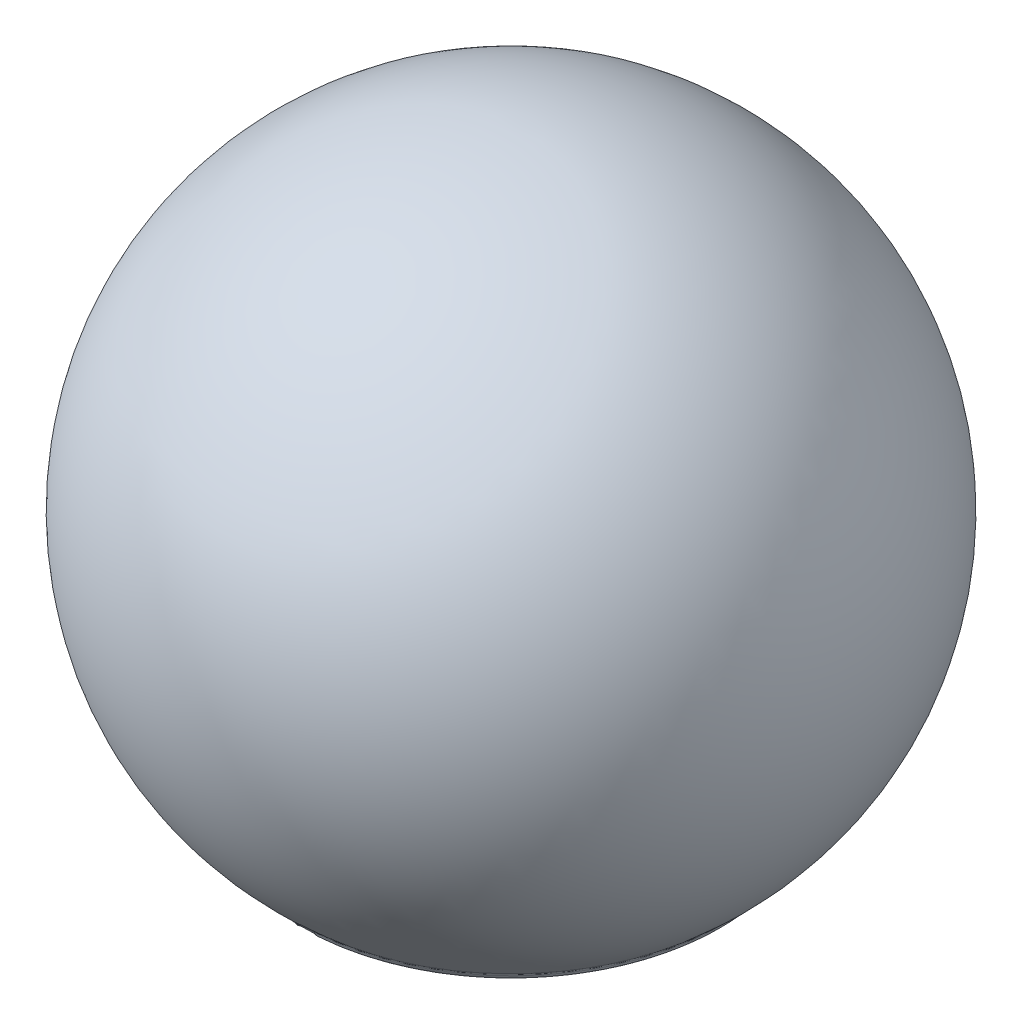
from build123d import *

# Parameters (mm, degrees)
CUT_EXTRUDE1_DEPTH = 65
SKETCH4_W          = 2.495898364
SKETCH4_H          = 1.5
FILLET1_R          = 1.5
FILLET2_R          = 1.5
FILLET3_R          = 1.5


with BuildPart() as part:
    # Sketch1 → Revolve1 (revolve)
    with BuildSketch(Plane.XY):
        with BuildLine():
            Line((0, 74.75), (0, 73.175))
            ThreePointArc((0, 73.175), (73.175, 0), (0, -73.175))
            Line((0, -73.175), (0, -74.75))
            ThreePointArc((0, -74.75), (74.75, 0), (0, 74.75))
        make_face()
    revolve(axis=Axis((0, 74.75, 0), (0, -1, 0)))

    # Sketch3 → Cut-Extrude1 (cut, symmetric)
    with BuildSketch(Plane.XY):
        Polygon((45.425, -57.368545389), (-45.425, -57.368545389), (-47.920898364, -57.368545389), (-47.920898364, -74.75), (47.920898364, -74.75), (47.920898364, -57.368545389), align=None)
    extrude(amount=CUT_EXTRUDE1_DEPTH, both=True, mode=Mode.SUBTRACT)

    # Sketch4 → Revolve2 (revolve)
    with BuildSketch(Plane.XY, mode=Mode.PRIVATE) as revolve2_sk:
        with Locations((46.672949182, -58.118545389)):
            Rectangle(SKETCH4_W, SKETCH4_H)
    revolve(revolve2_sk.sketch.rotate(Axis((0, -73.175, 0), (0, -1, 0)), 180), axis=Axis((0, -73.175, 0), (0, -1, 0)))

    # Fillet1
    fillet1_edges = [part.edges().sort_by_distance(p)[0] for p in [
        (47.920898364, -58.868545389, 0),
    ]]
    fillet(fillet1_edges, radius=FILLET1_R - 0.0001)  # a hair under: the kernel refuses the full size

    # Fillet2
    fillet2_edges = [part.edges().sort_by_distance(p)[0] for p in [
        (0, -57.368545389, -47.920898364),
    ]]
    fillet(fillet2_edges, radius=FILLET2_R)

    # Fillet3
    fillet3_edges = [part.edges().sort_by_distance(p)[0] for p in [
        (0, -57.368545389, -45.425),
    ]]
    fillet(fillet3_edges, radius=FILLET3_R)


solid = part.part
